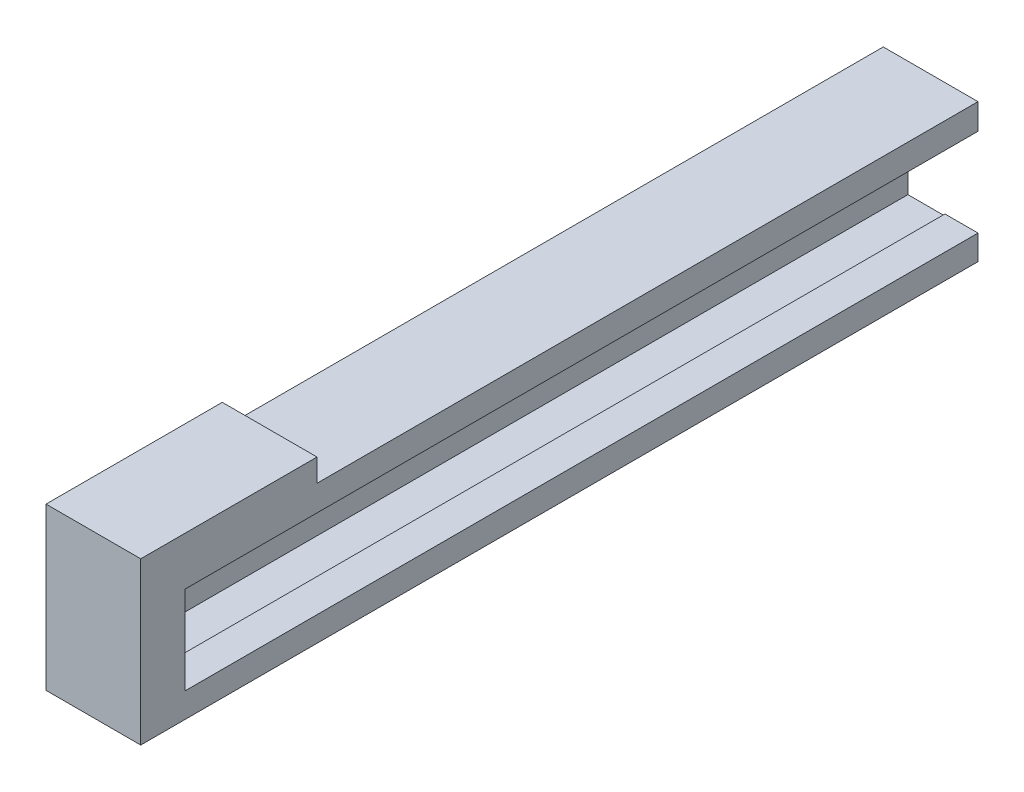
from build123d import *

# Parameters (mm, degrees)
BOSS_EXTRUDE3_DEPTH   = 90
BOSS_EXTRUDE3_2_DEPTH = 90
SKETCH3_W             = 10.75
SKETCH3_H             = 15.726491146
BOSS_EXTRUDE4_DEPTH   = 5
SKETCH4_W             = 10.75
SKETCH4_H             = 2.578461227
BOSS_EXTRUDE5_DEPTH   = 20


with BuildPart() as part:
    # Sketch2 → Boss-Extrude3 (new body)
    with BuildSketch(Plane.XY):
        Polygon((16.75, 6), (13, 6), (13, 5.8), (8.8, 5.8), (8.8, 8.3), (6, 8.3), (6, 3.186754427), (16.75, 3.186754427), align=None)
    extrude(amount=BOSS_EXTRUDE3_DEPTH)



with BuildPart() as body_2:
    # Sketch2 → Boss-Extrude3 2 (new body)
    with BuildSketch(Plane.XY):
        Polygon((6, 18.913245573), (6, 13.8), (8.7, 13.8), (8.7, 16.3), (13, 16.3), (13, 16), (16.75, 16), (16.75, 18.913245573), align=None)
    extrude(amount=BOSS_EXTRUDE3_2_DEPTH)


with BuildPart() as part_1:
    add(part.part)

    add(body_2.part)  # Boss-Extrude4 merges body 2
    # Sketch3 → Boss-Extrude4 (add)
    with BuildSketch(Plane.XY.offset(90)):
        with Locations((11.375, 11.05)):
            Rectangle(SKETCH3_W, SKETCH3_H)
    extrude(amount=BOSS_EXTRUDE4_DEPTH)

    # Sketch4 → Boss-Extrude5 (add)
    with BuildSketch(Plane.XY.offset(95)):
        with Locations((11.375, 20.202476187)):
            Rectangle(SKETCH4_W, SKETCH4_H)
    extrude(amount=-BOSS_EXTRUDE5_DEPTH)


solid = part_1.part
